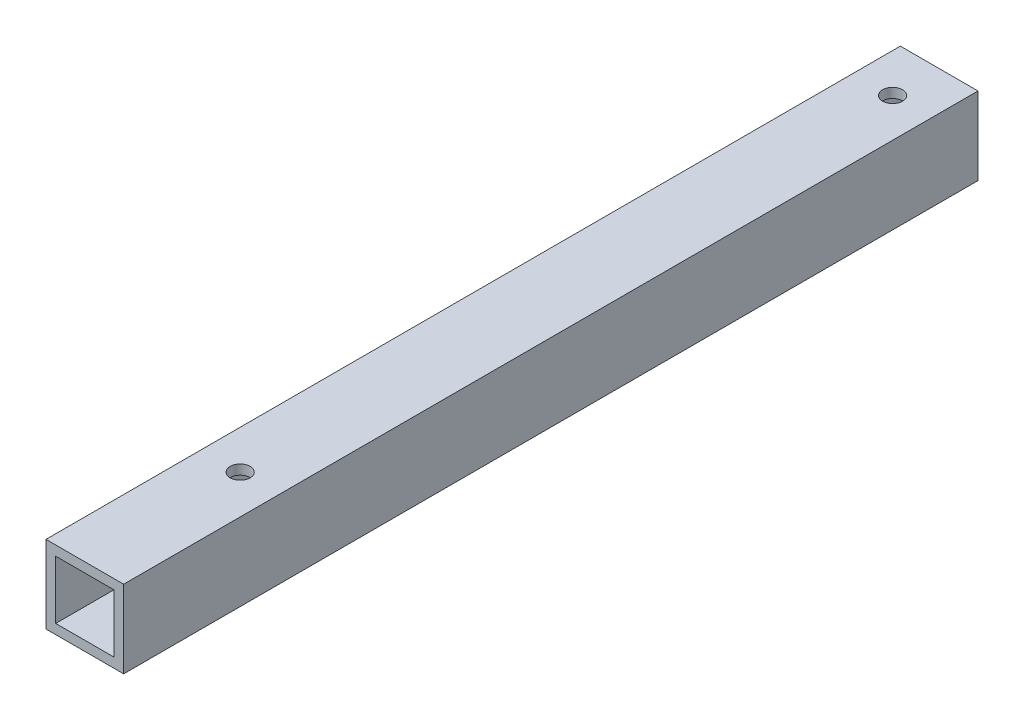
from build123d import *

# Parameters (mm, degrees)
SKETCH2_W           = 25.4
SKETCH2_H           = 25.4
BOSS_EXTRUDE1_DEPTH = 279.4
SKETCH4_W           = 19.05
SKETCH4_H           = 19.05
CUT_EXTRUDE1_DEPTH  = 280.9766776
SKETCH5_R           = 3.2639
CUT_EXTRUDE2_DEPTH  = 281.839473721
SKETCH6_R           = 3.2639
CUT_EXTRUDE3_DEPTH  = 281.839473721


with BuildPart() as part:
    # Sketch2 → Boss-Extrude1 (new body)
    with BuildSketch(Plane.XY):
        Rectangle(SKETCH2_W, SKETCH2_H)
    extrude(amount=BOSS_EXTRUDE1_DEPTH)

    # Sketch4 → Cut-Extrude1 (cut, through all)
    with BuildSketch(Plane.XY):
        Rectangle(SKETCH4_W, SKETCH4_H)
    extrude(amount=CUT_EXTRUDE1_DEPTH, mode=Mode.SUBTRACT)

    # Sketch5 → Cut-Extrude2 (cut, through all)
    with BuildSketch(Plane(origin=(0, 12.7, 0), x_dir=(1, 0, 0), z_dir=(0, 1, 0))):
        with Locations((0, -15.24)):
            Circle(SKETCH5_R)
    extrude(amount=-CUT_EXTRUDE2_DEPTH, mode=Mode.SUBTRACT)

    # Sketch6 → Cut-Extrude3 (cut, through all)
    with BuildSketch(Plane(origin=(0, 12.7, 0), x_dir=(1, 0, 0), z_dir=(0, 1, 0))):
        with Locations((0, -228.6)):
            Circle(SKETCH6_R)
    extrude(amount=-CUT_EXTRUDE3_DEPTH, mode=Mode.SUBTRACT)


solid = part.part
